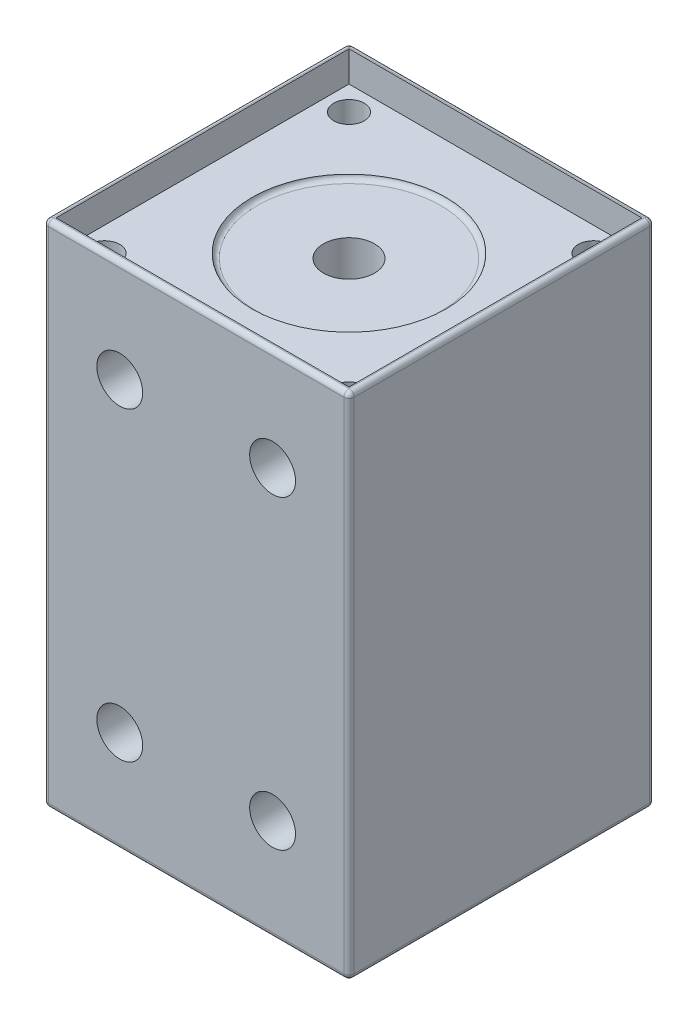
from build123d import *

# Parameters (mm, degrees)
SZKIC1_W                     = 60
SZKIC1_H                     = 60
DODANIE_WYCI_GNI_CIE1_DEPTH  = 100
SZKIC2_W                     = 57.5
SZKIC2_H                     = 57.5
WYTNIJ_WYCI_GNI_CIE1_DEPTH   = 6
SZKIC3_R                     = 5
WYTNIJ_WYCI_GNI_CIE2_DEPTH   = 24
SZKIC4_R                     = 19
WYTNIJ_WYCI_GNI_CIE3_DEPTH   = 0.9
ZAOKR_GLENIE1_R              = 1
OTWORY_USTALAJ_CE_6_0MM1_D   = 6
SZKIC8_R                     = 21
WYTNIJ_WYCI_GNI_CIE5_DEPTH   = 70
ZAOKR_GLENIE2_R              = 1
OTW_R_POD_RUB_M81_AT_2_COUNT = 2
OTW_R_POD_RUB_M81_AT_2_PITCH = 30
OTW_R_POD_RUB_M81_AT_3_COUNT = 2
OTW_R_POD_RUB_M81_AT_3_PITCH = 67.082039325
OTW_R_POD_RUB_M81_AT_4_COUNT = 2
OTW_R_POD_RUB_M81_AT_4_PITCH = 60


with BuildPart() as part:
    # Szkic1 → Dodanie-wyciągnięcie1 (new body)
    with BuildSketch(Plane(origin=(0, 0, 0), x_dir=(1, 0, 0), z_dir=(0, 1, 0))):
        Rectangle(SZKIC1_W, SZKIC1_H)
    extrude(amount=DODANIE_WYCI_GNI_CIE1_DEPTH)

    # Szkic2 → Wytnij-wyciągnięcie1 (cut)
    with BuildSketch(Plane(origin=(0, 100, 0), x_dir=(1, 0, 0), z_dir=(0, 1, 0))):
        Rectangle(SZKIC2_W, SZKIC2_H)
    extrude(amount=-WYTNIJ_WYCI_GNI_CIE1_DEPTH, mode=Mode.SUBTRACT)

    # Szkic3 → Wytnij-wyciągnięcie2 (cut)
    with BuildSketch(Plane(origin=(0, 94, 0), x_dir=(1, 0, 0), z_dir=(0, 1, 0))):
        with Locations(Location((0, 0, 0), (0, 0, 270))):
            Circle(SZKIC3_R)
    extrude(amount=-WYTNIJ_WYCI_GNI_CIE2_DEPTH, mode=Mode.SUBTRACT)

    # Szkic4 → Wytnij-wyciągnięcie3 (cut)
    with BuildSketch(Plane(origin=(0, 94, 0), x_dir=(1, 0, 0), z_dir=(0, 1, 0))):
        with Locations(Location((0, 0, 0), (0, 0, 270))):
            Circle(SZKIC4_R)
    extrude(amount=-WYTNIJ_WYCI_GNI_CIE3_DEPTH, mode=Mode.SUBTRACT)

    # Zaokrąglenie1
    # the kernel refuses this fillet: 1 mm, written as the material it adds along each edge
    with BuildSketch(Plane(origin=(0, 93.1, 0), x_dir=(0, 0, 1), z_dir=(-1, 0, 0))) as zaokr_glenie1_piece_1:
        with BuildLine():
            CenterArc((18.005012563, 1), ZAOKR_GLENIE1_R, 270, 84.260829523)
            Line((18.005012563, 0), (18.005012563, -0.02))
            Line((18.005012563, -0.02), (19, -0.02))
            Line((19, -0.02), (19.02, 0))
            ThreePointArc((19.02, 0), (19.02, 0.45), (19.019899749, 0.898))
            Line((19.019899749, 0.898), (19, 0.9))
        make_face()
    revolve(axis=Axis((0, 93.1, 0), (0, 1, 0)))

    # Otwory ustalające Ø6.0mm1 (through all)
    with Locations(Plane(origin=(0, 94, 0), x_dir=(1, 0, 0), z_dir=(0, 1, 0))):
        with Locations((-24, 24), (24, 24), (24, -24), (-24, -24)):
            Hole(OTWORY_USTALAJ_CE_6_0MM1_D / 2)

    # Szkic8 → Wytnij-wyciągnięcie5 (cut)
    with BuildSketch(Plane.XZ):
        with Locations(Location((0, 0, 0), (0, 0, 270))):
            Circle(SZKIC8_R)
    extrude(amount=-WYTNIJ_WYCI_GNI_CIE5_DEPTH, mode=Mode.SUBTRACT)

    # Zaokrąglenie2
    zaokr_glenie2_edges = [part.edges().sort_by_distance(p)[0] for p in [
        (30, 100, 0),
        (0, 100, -30),
        (-30, 100, 0),
        (0, 0, -30),
        (30, 0, 0),
        (0, 0, 30),
        (-30, 0, 0),
        (-30, 50, -30),
        (30, 50, -30),
        (30, 50, 30),
        (-30, 50, 30),
        (0, 100, 30),
    ]]
    fillet(zaokr_glenie2_edges, radius=ZAOKR_GLENIE2_R)

    # Szkic11 → Otwór pod śrubę M81 (revolve, cut)
    with BuildSketch(Plane(origin=(15, 80, -30), x_dir=(0, 1, 0), z_dir=(1, 0, 0))):
        Polygon((0, 0), (0, 12.703872786), (4.5, 10), (4.5, 0), align=None)
    otw_r_pod_rub_m81 = revolve(axis=Axis((15, 80, -36.35), (0, 0, 1)), mode=Mode.SUBTRACT)

    # Otwór pod śrubę M81 at 2: Otwór pod śrubę M81 ×2
    with Locations(*[(-i * OTW_R_POD_RUB_M81_AT_2_PITCH, 0, 0) for i in range(1, OTW_R_POD_RUB_M81_AT_2_COUNT)]):
        add(otw_r_pod_rub_m81, mode=Mode.SUBTRACT)

    # Otwór pod śrubę M81 at 3: Otwór pod śrubę M81 ×2
    with Locations(*[Vector(-0.4472135954999577, -0.894427190999916, 0) * (i * OTW_R_POD_RUB_M81_AT_3_PITCH) for i in range(1, OTW_R_POD_RUB_M81_AT_3_COUNT)]):
        add(otw_r_pod_rub_m81, mode=Mode.SUBTRACT)

    # Otwór pod śrubę M81 at 4: Otwór pod śrubę M81 ×2
    with Locations(*[(0, -i * OTW_R_POD_RUB_M81_AT_4_PITCH, 0) for i in range(1, OTW_R_POD_RUB_M81_AT_4_COUNT)]):
        add(otw_r_pod_rub_m81, mode=Mode.SUBTRACT)

    # Lustro1: Otwór pod śrubę M81 across plane
    add(otw_r_pod_rub_m81.mirror(Plane.XY), mode=Mode.SUBTRACT)

    # Lustro1 copy 1 sketch → Lustro1 copy 1 (revolve, cut)
    with BuildSketch(Plane(origin=(-15, 80, 30), x_dir=(0, 1, 0), z_dir=(1, 0, 0))):
        Polygon((0, 0), (0, -12.703872786), (4.5, -10), (4.5, 0), align=None)
    revolve(axis=Axis((-15, 80, 36.35), (0, 0, 1)), mode=Mode.SUBTRACT)

    # Lustro1 copy 2 sketch → Lustro1 copy 2 (revolve, cut)
    with BuildSketch(Plane(origin=(-15, 20, 30), x_dir=(0, 1, 0), z_dir=(1, 0, 0))):
        Polygon((0, 0), (0, -12.703872786), (4.5, -10), (4.5, 0), align=None)
    revolve(axis=Axis((-15, 20, 36.35), (0, 0, 1)), mode=Mode.SUBTRACT)

    # Lustro1 copy 3 sketch → Lustro1 copy 3 (revolve, cut)
    with BuildSketch(Plane(origin=(15, 20, 30), x_dir=(0, 1, 0), z_dir=(1, 0, 0))):
        Polygon((0, 0), (0, -12.703872786), (4.5, -10), (4.5, 0), align=None)
    revolve(axis=Axis((15, 20, 36.35), (0, 0, 1)), mode=Mode.SUBTRACT)


solid = part.part
